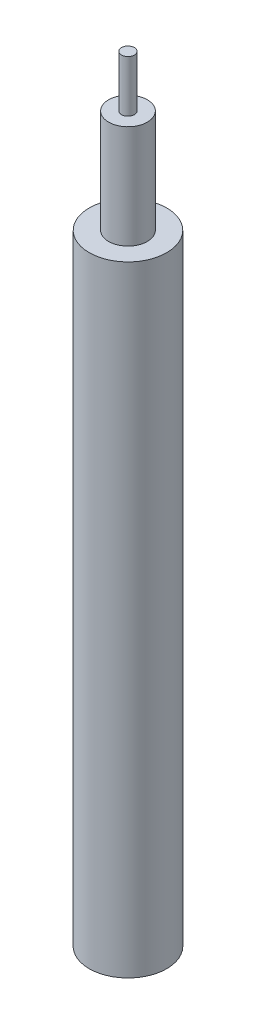
from build123d import *

# Parameters (mm, degrees)
SKETCH1_R           = 2.38125
BOSS_EXTRUDE1_DEPTH = 12.7
SKETCH2_R           = 4.7625
BOSS_EXTRUDE2_DEPTH = 76.2
SKETCH3_R           = 0.79375
BOSS_EXTRUDE3_DEPTH = 6.35


with BuildPart() as part:
    # Sketch1 → Boss-Extrude1 (new body)
    with BuildSketch(Plane(origin=(0, 0, 0), x_dir=(1, 0, 0), z_dir=(0, 1, 0))):
        Circle(SKETCH1_R)
    extrude(amount=-BOSS_EXTRUDE1_DEPTH)

    # Sketch2 → Boss-Extrude2 (add)
    with BuildSketch(Plane(origin=(0, -12.7, 0), x_dir=(-1, 0, 0), z_dir=(0, -1, 0))):
        Circle(SKETCH2_R)
    extrude(amount=BOSS_EXTRUDE2_DEPTH)

    # Sketch3 → Boss-Extrude3 (add)
    with BuildSketch(Plane(origin=(0, 0, 0), x_dir=(1, 0, 0), z_dir=(0, 1, 0))):
        Circle(SKETCH3_R)
    extrude(amount=BOSS_EXTRUDE3_DEPTH)


solid = part.part
